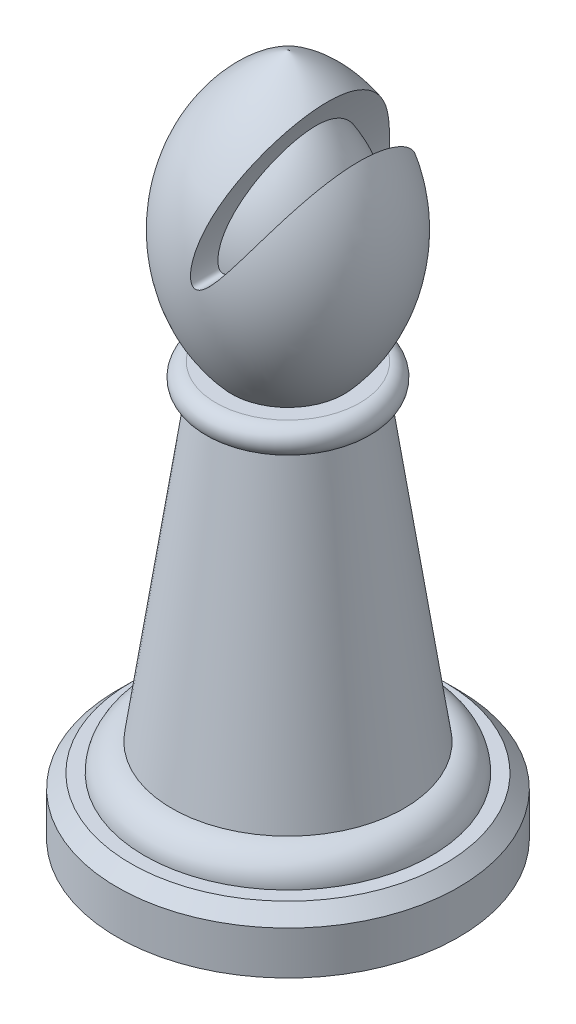
from build123d import *

# Parameters (mm, degrees)
FILLET1_R               = 1.524
CHAMFER1_SIZE           = 0.762
CUT_EXTRUDE1_DEPTH      = 41.411152639
CUT_EXTRUDE1_DEPTH_BACK = 41.411152639
SKETCH3_RX              = 6.8453
SKETCH3_RY              = 1.2192


with BuildPart() as part:
    # Sketch2 → Revolve1 (revolve)
    with BuildSketch(Plane.XY, mode=Mode.PRIVATE) as revolve1_sk:
        with BuildLine():
            Line((0, 0), (-9.525, 0))
            Line((-9.525, 0), (-9.525, 3.175))
            Line((-9.525, 3.175), (-8.001, 3.175))
            Line((-8.001, 3.175), (-8.001, 4.699))
            Line((-8.001, 4.699), (-6.477, 4.699))
            Line((-6.477, 4.699), (-4.0386, 21.5392))
            ThreePointArc((-4.0386, 21.5392), (-4.775092358, 22.313794174), (-4.01298473, 23.0632))
            Line((-4.01298473, 23.0632), (-3.1496, 23.0632))
            ThreePointArc((-3.1496, 23.0632), (-5.385123327, 31.379708264), (0, 38.1))
            Line((0, 38.1), (0, 0))
        make_face()
    revolve(revolve1_sk.sketch.rotate(Axis((0, 0, 0), (0, 1, 0)), 270), axis=Axis((0, 0, 0), (0, 1, 0)))

    # Fillet1
    fillet1_edges = [part.edges().sort_by_distance(p)[0] for p in [
        (0, 4.699, 8.001),
    ]]
    fillet(fillet1_edges, radius=FILLET1_R - 0.0001)  # a hair under: the kernel refuses the full size

    # Chamfer1
    chamfer1_edges = [part.edges().sort_by_distance(p)[0] for p in [
        (0, 3.175, 9.525),
    ]]
    chamfer(chamfer1_edges, length=CHAMFER1_SIZE)

    # Sketch3 → Cut-Extrude1 (cut, two sides: drawn at the far end of the back side and taken through both)
    with BuildSketch(Plane.XY.offset(-CUT_EXTRUDE1_DEPTH_BACK)):
        with Locations(Location((3.136027313, 35.805849793), (0, 0, 65.87786559))):
            Ellipse(SKETCH3_RX, SKETCH3_RY)
    extrude(amount=CUT_EXTRUDE1_DEPTH + CUT_EXTRUDE1_DEPTH_BACK, mode=Mode.SUBTRACT)

    # Sketch4 → Revolve2 (revolve)
    with BuildSketch(Plane.XY, mode=Mode.PRIVATE) as revolve2_sk:
        with BuildLine():
            Line((0, 36.392009835), (0, 24.08140533))
            Line((0, 24.08140533), (-2.015653835, 24.08140533))
            ThreePointArc((-2.015653835, 24.08140533), (-3.958298201, 30.719797487), (0, 36.392009835))
        make_face()
    revolve(revolve2_sk.sketch.rotate(Axis((0, 38.1, 0), (0, -1, 0)), 90), axis=Axis((0, 38.1, 0), (0, -1, 0)))


solid = part.part
